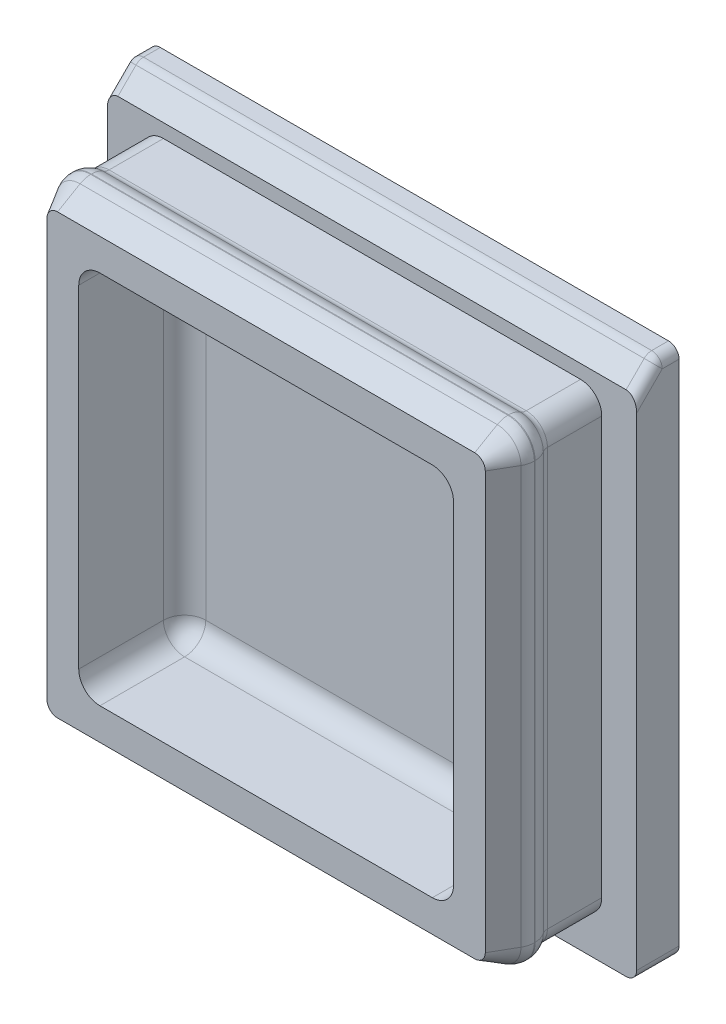
from build123d import *

# Parameters (mm, degrees)
SKIZZE1_W                       = 25
SKIZZE1_H                       = 25
AUFSATZ_LINEAR_AUSTRAGEN1_DEPTH = 2
SKIZZE2_W                       = 21.7
SKIZZE2_H                       = 21.7
SKIZZE2_W_2                     = 17.7
SKIZZE2_H_2                     = 17.7
LINEAR_AUSTRAGEN_D_NN1_DEPTH    = 5
VERRUNDUNG1_R                   = 1
LINEAR_AUSTRAGEN_D_NN2_DEPTH    = 2
FASE1_SIZE                      = 0.75
FASE1_SIZE2                     = 1.299038106
VERRUNDUNG2_R                   = 0.5
VERRUNDUNG3_R                   = 1
FASE2_SIZE                      = 1
VERRUNDUNG5_R                   = 0.5
VERRUNDUNG4_R                   = 0.5
VERRUNDUNG6_R                   = 1


with BuildPart() as part:
    # Skizze1 → Aufsatz-Linear austragen1 (new body)
    with BuildSketch(Plane.XY):
        Rectangle(SKIZZE1_W, SKIZZE1_H)
    extrude(amount=AUFSATZ_LINEAR_AUSTRAGEN1_DEPTH)

    # Skizze2 → Linear-Austragen-Dünn1 (add)
    with BuildSketch(Plane.XY.offset(2)):
        Rectangle(SKIZZE2_W, SKIZZE2_H)
        Rectangle(SKIZZE2_W_2, SKIZZE2_H_2, mode=Mode.SUBTRACT)
    extrude(amount=LINEAR_AUSTRAGEN_D_NN1_DEPTH)

    # Verrundung1
    verrundung1_edges = [part.edges().sort_by_distance(p)[0] for p in [
        (-10.85, -10.85, 4.5),
        (10.85, -10.85, 4.5),
        (10.85, 10.85, 4.5),
        (-10.85, 10.85, 4.5),
    ]]
    fillet(verrundung1_edges, radius=VERRUNDUNG1_R)

    # Skizze3 → Linear-Austragen-Dünn2 (add)
    with BuildSketch(Plane.XY.offset(7)):
        with BuildLine():
            Line((9.85, 11.1), (-9.85, 11.1))
            ThreePointArc((-9.85, 11.1), (-10.733883476, 10.733883476), (-11.1, 9.85))
            Line((-11.1, 9.85), (-11.1, -9.85))
            ThreePointArc((-11.1, -9.85), (-10.733883476, -10.733883476), (-9.85, -11.1))
            Line((-9.85, -11.1), (9.85, -11.1))
            ThreePointArc((9.85, -11.1), (10.733883476, -10.733883476), (11.1, -9.85))
            Line((11.1, -9.85), (11.1, 9.85))
            ThreePointArc((11.1, 9.85), (10.733883476, 10.733883476), (9.85, 11.1))
        make_face()
        with BuildLine():
            Line((9.85, 10.85), (-9.85, 10.85))
            ThreePointArc((-9.85, 10.85), (-10.557106781, 10.557106781), (-10.85, 9.85))
            Line((-10.85, 9.85), (-10.85, -9.85))
            ThreePointArc((-10.85, -9.85), (-10.557106781, -10.557106781), (-9.85, -10.85))
            Line((-9.85, -10.85), (9.85, -10.85))
            ThreePointArc((9.85, -10.85), (10.557106781, -10.557106781), (10.85, -9.85))
            Line((10.85, -9.85), (10.85, 9.85))
            ThreePointArc((10.85, 9.85), (10.557106781, 10.557106781), (9.85, 10.85))
        make_face(mode=Mode.SUBTRACT)
    extrude(amount=-LINEAR_AUSTRAGEN_D_NN2_DEPTH)

    # Fase1
    fase1_edges = [part.edges().sort_by_distance(p)[0] for p in [
        (10.733883476, 10.733883476, 7),
        (0, 11.1, 7),
        (-10.733883476, 10.733883476, 7),
        (-11.1, 0, 7),
        (-10.733883476, -10.733883476, 7),
        (0, -11.1, 7),
        (10.733883476, -10.733883476, 7),
        (11.1, 0, 7),
    ]]
    fase1_side = [part.faces().sort_by_distance(p)[0] for p in [
        (10.511883476, 10.511883476, 7),
    ]]
    chamfer(fase1_edges, length=FASE1_SIZE, length2=FASE1_SIZE2, reference=fase1_side[0])

    # Verrundung2
    # the kernel refuses this fillet: 0.5 mm, written as the material it adds along each edge
    with BuildSketch(Plane(origin=(10.85, -9.85, 5), x_dir=(1, 0, 0), z_dir=(0, 1, 0)), Plane(origin=(9.85, 10.85, 5), x_dir=(0, 1, 0), z_dir=(-1, 0, 0)), Plane(origin=(-10.85, 9.85, 5), x_dir=(-1, 0, 0), z_dir=(0, -1, 0)), Plane(origin=(-9.85, -10.85, 5), x_dir=(0, -1, 0), z_dir=(1, 0, 0))) as verrundung2_piece_1:
        with BuildLine():
            CenterArc((0.5, 0.433012702), VERRUNDUNG2_R, 180, 60)
            Line((0, 0.433012702), (-0.01, 0.433012702))
            Line((-0.01, 0.433012702), (-0.01, 0))
            Line((-0.01, 0), (0, -0.01))
            ThreePointArc((0, -0.01), (0.125, -0.01), (0.245, -0.008660254))
            Line((0.245, -0.008660254), (0.25, 0))
        make_face()
    extrude(amount=19.7)
    with BuildSketch(Plane(origin=(9.85, 9.85, 5), x_dir=(1, 0, 0), z_dir=(0, -1, 0))) as verrundung2_piece_2:
        with BuildLine():
            CenterArc((1.5, -0.433012702), VERRUNDUNG2_R, 120, 60)
            Line((1, -0.433012702), (0.99, -0.433012702))
            Line((0.99, -0.433012702), (0.99, 0))
            Line((0.99, 0), (1, 0.01))
            ThreePointArc((1, 0.01), (1.125, 0.01), (1.245, 0.008660254))
            Line((1.245, 0.008660254), (1.25, 0))
        make_face()
    revolve(axis=Axis((9.85, 9.85, 5), (0, 0, 1)), revolution_arc=90)
    with BuildSketch(Plane(origin=(-9.85, 9.85, 5), x_dir=(0, 1, 0), z_dir=(1, 0, 0))) as verrundung2_piece_3:
        with BuildLine():
            CenterArc((1.5, -0.433012702), VERRUNDUNG2_R, 120, 60)
            Line((1, -0.433012702), (0.99, -0.433012702))
            Line((0.99, -0.433012702), (0.99, 0))
            Line((0.99, 0), (1, 0.01))
            ThreePointArc((1, 0.01), (1.125, 0.01), (1.245, 0.008660254))
            Line((1.245, 0.008660254), (1.25, 0))
        make_face()
    revolve(axis=Axis((-9.85, 9.85, 5), (0, 0, 1)), revolution_arc=90)
    with BuildSketch(Plane(origin=(-9.85, -9.85, 5), x_dir=(-1, 0, 0), z_dir=(0, 1, 0))) as verrundung2_piece_4:
        with BuildLine():
            CenterArc((1.5, -0.433012702), VERRUNDUNG2_R, 120, 60)
            Line((1, -0.433012702), (0.99, -0.433012702))
            Line((0.99, -0.433012702), (0.99, 0))
            Line((0.99, 0), (1, 0.01))
            ThreePointArc((1, 0.01), (1.125, 0.01), (1.245, 0.008660254))
            Line((1.245, 0.008660254), (1.25, 0))
        make_face()
    revolve(axis=Axis((-9.85, -9.85, 5), (0, 0, 1)), revolution_arc=90)
    with BuildSketch(Plane(origin=(9.85, -9.85, 5), x_dir=(0, -1, 0), z_dir=(-1, 0, 0))) as verrundung2_piece_5:
        with BuildLine():
            CenterArc((1.5, -0.433012702), VERRUNDUNG2_R, 120, 60)
            Line((1, -0.433012702), (0.99, -0.433012702))
            Line((0.99, -0.433012702), (0.99, 0))
            Line((0.99, 0), (1, 0.01))
            ThreePointArc((1, 0.01), (1.125, 0.01), (1.245, 0.008660254))
            Line((1.245, 0.008660254), (1.25, 0))
        make_face()
    revolve(axis=Axis((9.85, -9.85, 5), (0, 0, 1)), revolution_arc=90)

    # Verrundung3
    verrundung3_edges = [part.edges().sort_by_distance(p)[0] for p in [
        (0, -11.1, 5.700961894),
        (10.733883476, -10.733883476, 5.700961894),
        (-10.733883476, -10.733883476, 5.700961894),
        (11.1, 0, 5.700961894),
        (-11.1, 0, 5.700961894),
        (10.733883476, 10.733883476, 5.700961894),
        (-10.733883476, 10.733883476, 5.700961894),
        (0, 11.1, 5.700961894),
        (10.733883476, 10.733883476, 5),
        (11.1, 0, 5),
        (10.733883476, -10.733883476, 5),
        (0, -11.1, 5),
        (-10.733883476, -10.733883476, 5),
        (-11.1, 0, 5),
        (-10.733883476, 10.733883476, 5),
        (0, 11.1, 5),
    ]]
    fillet(verrundung3_edges, radius=VERRUNDUNG3_R)

    # Fase2
    fase2_edges = [part.edges().sort_by_distance(p)[0] for p in [
        (0, 12.5, 2),
    ]]
    chamfer(fase2_edges, length=FASE2_SIZE)

    # Verrundung5
    verrundung5_edges = [part.edges().sort_by_distance(p)[0] for p in [
        (0, 12.5, 1),
    ]]
    fillet(verrundung5_edges, radius=VERRUNDUNG5_R)

    # Verrundung4
    verrundung4_edges = [part.edges().sort_by_distance(p)[0] for p in [
        (-12.5, 11.926776695, 1.573223305),
        (-12.5, 12.5, 0.396446609),
        (12.5, 12.5, 0.396446609),
        (12.5, 11.926776695, 1.573223305),
        (12.5, 12.461939766, 0.984234935),
        (-12.5, 12.461939766, 0.984234935),
        (12.5, -12.5, 1),
        (-12.5, -12.5, 1),
    ]]
    fillet(verrundung4_edges, radius=VERRUNDUNG4_R)

    # Verrundung6
    verrundung6_edges = [part.edges().sort_by_distance(p)[0] for p in [
        (0, -8.85, 2),
        (8.85, 0, 2),
        (0, 8.85, 2),
        (-8.85, 0, 2),
        (8.85, -8.85, 4.5),
        (8.85, 8.85, 4.5),
        (-8.85, 8.85, 4.5),
        (-8.85, -8.85, 4.5),
    ]]
    fillet(verrundung6_edges, radius=VERRUNDUNG6_R)


solid = part.part
